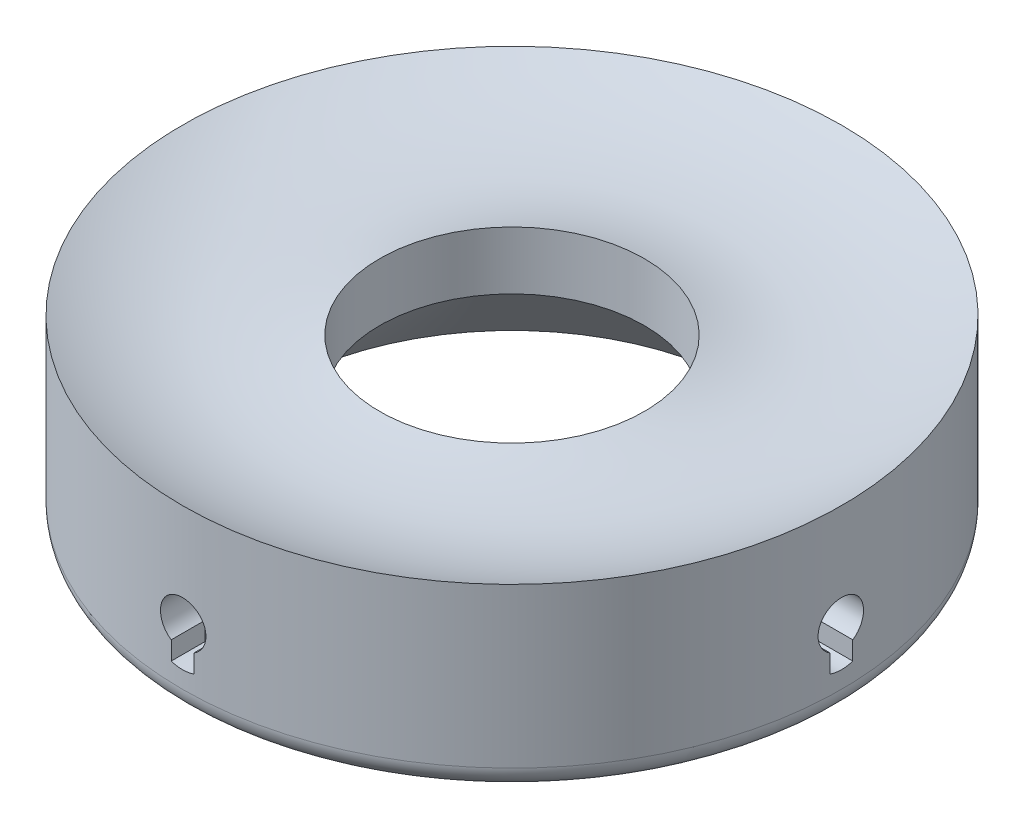
from build123d import *
from build123d.topology import SkipClean

# Parameters (mm, degrees)
SKETCH1_R           = 36.83
BOSS_EXTRUDE1_DEPTH = 20.32
FILLET1_R           = 2.54
SKETCH2_R           = 26.67
SKETCH3_R           = 14.7955
SKETCH4_R           = 14.7955
CUT_EXTRUDE1_DEPTH  = 76.2
SKETCH8_R           = 2.54
CUT_EXTRUDE2_DEPTH  = 6.35
CIRPATTERN1_COUNT   = 4
CUT_EXTRUDE3_DEPTH  = 6.35
SKETCH10_R          = 4.445
CUT_EXTRUDE4_DEPTH  = 2.54
BOSS_EXTRUDE2_DEPTH = 2.54
BOSS_EXTRUDE3_DEPTH = 6.35
SKETCH13_R          = 39.975148753
SKETCH13_R_2        = 36.83
CUT_EXTRUDE5_DEPTH  = 21.59
CIRPATTERN2_COUNT   = 4


with BuildPart() as part:
    # Sketch1 → Boss-Extrude1 (new body)
    with BuildSketch(Plane(origin=(0, 0, 0), x_dir=(1, 0, 0), z_dir=(0, 1, 0))):
        with Locations(Location((0, 0, 0), (0, 0, 270))):
            Circle(SKETCH1_R)
    extrude(amount=BOSS_EXTRUDE1_DEPTH)

    # Fillet1
    fillet1_edges = [part.edges().sort_by_distance(p)[0] for p in [
        (0, 0, -36.83),
    ]]
    fillet(fillet1_edges, radius=FILLET1_R)

    # Sketch2 → Cut-Loft1 section 0
    with BuildSketch(Plane(origin=(0, 0, 0), x_dir=(1, 0, 0), z_dir=(0, 1, 0))):
        Circle(SKETCH2_R)
    # Sketch3 → Cut-Loft1 section 1
    with BuildSketch(Plane(origin=(0, 11.938, 0), x_dir=(1, 0, 0), z_dir=(0, 1, 0))):
        Circle(SKETCH3_R)
    loft(mode=Mode.SUBTRACT)

    # Sketch4 → Cut-Extrude1 (cut)
    with BuildSketch(Plane.XZ.offset(-11.938)):
        with Locations(Location((0, 0, 0), (0, 0, 270))):
            Circle(SKETCH4_R)
    extrude(amount=-CUT_EXTRUDE1_DEPTH, mode=Mode.SUBTRACT)

    # Sketch8 → Cut-Extrude2 (cut)
    with BuildSketch(Plane.XY.offset(36.83)):
        with Locations((0, 8.89)):
            Circle(SKETCH8_R)
    cut_extrude2 = extrude(amount=-CUT_EXTRUDE2_DEPTH, mode=Mode.SUBTRACT)

    # CirPattern1: Cut-Extrude2 ×4 about axis
    cirpattern1_axis = Axis((0, 0, 0), (0, 1, 0))
    for i in range(1, CIRPATTERN1_COUNT):
        add(cut_extrude2.rotate(cirpattern1_axis, i * 360 / CIRPATTERN1_COUNT), mode=Mode.SUBTRACT)

    # Sketch9 → Cut-Extrude3 (cut)
    with BuildSketch(Plane.XY.offset(36.83)):
        with BuildLine():
            Line((-1.27, 4.445), (1.27, 4.445))
            Line((1.27, 4.445), (1.27, 6.690295474))
            ThreePointArc((1.27, 6.690295474), (0, 6.35), (-1.27, 6.690295474))
            Line((-1.27, 6.690295474), (-1.27, 4.445))
        make_face()
    cut_extrude3 = extrude(amount=-CUT_EXTRUDE3_DEPTH, mode=Mode.SUBTRACT)

    # Sketch10 → Cut-Extrude4 (cut)
    with BuildSketch(Plane.XY.offset(30.48)):
        with Locations((0, 8.89)):
            Circle(SKETCH10_R)
    cut_extrude4 = extrude(amount=CUT_EXTRUDE4_DEPTH, mode=Mode.SUBTRACT)

    # Sketch11 → Boss-Extrude2 (add)
    with BuildSketch(Plane.XY.offset(30.48)):
        with BuildLine():
            Line((-2.54, 8.89), (-4.445, 8.89))
            ThreePointArc((-4.445, 8.89), (2.656395584, 12.453928661), (1.27, 4.630290503))
            Line((1.27, 4.630290503), (1.27, 6.690295474))
            ThreePointArc((1.27, 6.690295474), (1.27, 11.089704526), (-2.54, 8.89))
        make_face()
    boss_extrude2 = extrude(amount=BOSS_EXTRUDE2_DEPTH)

    # Sketch12 → Boss-Extrude3 (add)
    with BuildSketch(Plane.XY.offset(30.48)):
        with BuildLine():
            Line((-1.27, 4.445), (-1.1e-08, 4.445))
            ThreePointArc((-1.1e-08, 4.445), (-0.641722798, 4.491566546), (-1.27, 4.630290503))
            Line((-1.27, 4.630290503), (-1.27, 4.445))
        make_face()
        with BuildLine():
            Line((-1.1e-08, 4.445), (1.27, 4.445))
            Line((1.27, 4.445), (1.27, 4.630290503))
            ThreePointArc((1.27, 4.630290503), (0.641722787, 4.491566544), (-1.1e-08, 4.445))
        make_face()
    boss_extrude3 = extrude(amount=BOSS_EXTRUDE3_DEPTH)

    # Sketch13 → Cut-Extrude5 (cut)
    with BuildSketch(Plane.XZ):
        Circle(SKETCH13_R)
        with Locations(Location((0, 0, 0), (0, 0, 90))):
            Circle(SKETCH13_R_2, mode=Mode.SUBTRACT)
    cut_extrude5 = extrude(amount=-CUT_EXTRUDE5_DEPTH, mode=Mode.SUBTRACT)

    # CirPattern2: Cut-Extrude3, Cut-Extrude4, Boss-Extrude2, Boss-Extrude3, Cut-Extrude5 ×4 about axis
    with SkipClean():  # the faces are left unmerged after this step: merging them gives an invalid solid
        cirpattern2_axis = Axis((0, 0, 0), (0, 1, 0))
        add([cut_extrude3.rotate(cirpattern2_axis, i * 360 / CIRPATTERN2_COUNT) for i in range(1, CIRPATTERN2_COUNT)], mode=Mode.SUBTRACT)
        add([cut_extrude4.rotate(cirpattern2_axis, i * 360 / CIRPATTERN2_COUNT) for i in range(1, CIRPATTERN2_COUNT)], mode=Mode.SUBTRACT)
        add([boss_extrude2.rotate(cirpattern2_axis, i * 360 / CIRPATTERN2_COUNT) for i in range(1, CIRPATTERN2_COUNT)])
        add([boss_extrude3.rotate(cirpattern2_axis, i * 360 / CIRPATTERN2_COUNT) for i in range(1, CIRPATTERN2_COUNT)])
        add([cut_extrude5.rotate(cirpattern2_axis, i * 360 / CIRPATTERN2_COUNT) for i in range(1, CIRPATTERN2_COUNT)], mode=Mode.SUBTRACT)
    add(part.part.scale(1), mode=Mode.REPLACE)  # the faces are merged on a copy

    # Sketch17 → Cut-Revolve1 (revolve, cut)
    with BuildSketch(Plane(origin=(0, 0, 0), x_dir=(0, 0, -1), z_dir=(1, 0, 0))):
        with BuildLine():
            Line((36.83, 20.32), (14.7955, 20.32))
            Line((14.7955, 20.32), (14.7955, 18.415))
            ThreePointArc((14.7955, 18.415), (25.983986176, 17.386868237), (36.83, 20.32))
        make_face()
    revolve(axis=Axis((0, 0, 0), (0, 1, 0)), mode=Mode.SUBTRACT)


solid = part.part
